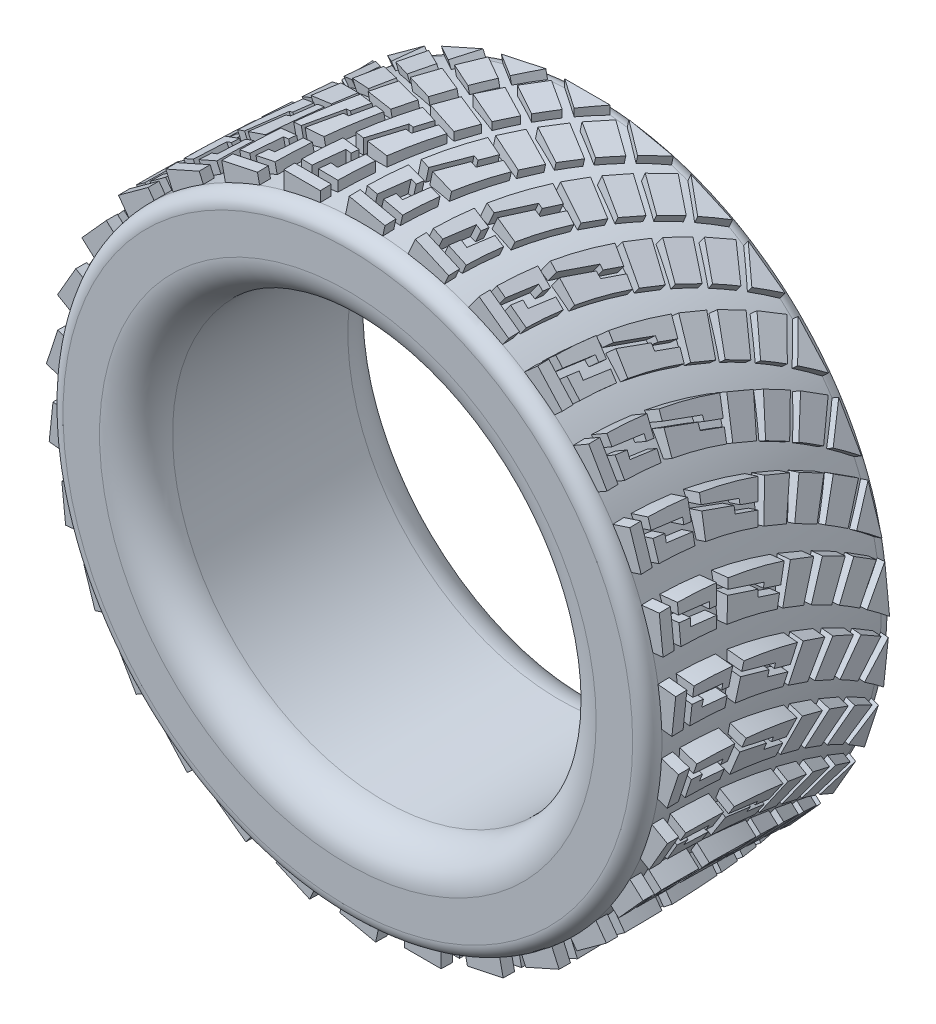
from build123d import *
from OCP.BRepFilletAPI import BRepFilletAPI_MakeFillet

# Parameters (mm, degrees)
SKETCH1_R           = 41
SKETCH1_R_2         = 29
EXTRUDE_THIN1_DEPTH = 34
FILLET2_R1          = 2
FILLET2_R2          = 5
BOSS_EXTRUDE1_START = -2.449619358
BOSS_EXTRUDE1_DEPTH = 2.449619358
CIRPATTERN1_COUNT   = 30


with BuildPart() as part:
    # Sketch1 → Extrude-Thin1 (new body)
    with BuildSketch(Plane.XY):
        Circle(SKETCH1_R)
        Circle(SKETCH1_R_2, mode=Mode.SUBTRACT)
    extrude(amount=EXTRUDE_THIN1_DEPTH)

    # Fillet2: one fillet with a radius per group of edges: ONE call of the kernel's fillet builder (fillet() takes one radius for all edges)
    fillet2_edges_1 = [part.edges().sort_by_distance(p)[0] for p in [
        (-41, 0, 34),
        (-41, 0, 0),
    ]]
    fillet2_edges_2 = [part.edges().sort_by_distance(p)[0] for p in [
        (-29, 0, 34),
        (-29, 0, 0),
    ]]
    fillet2 = BRepFilletAPI_MakeFillet(part.part.solid().wrapped)
    for e in fillet2_edges_1:
        fillet2.Add(FILLET2_R1, e.wrapped)
    for e in fillet2_edges_2:
        fillet2.Add(FILLET2_R2, e.wrapped)
    add(Compound.cast(fillet2.Shape()), mode=Mode.REPLACE)

    # Boss-Extrude1: read off the stored shape, not the designer's step
    # Boss-Extrude1 outline → Boss-Extrude1 (add)
    with BuildSketch(Plane(origin=(0, 42, 0), x_dir=(1, 0, 0), z_dir=(0, 1, 0)).offset(BOSS_EXTRUDE1_START)):
        with BuildLine():
            Line((-6.258934796, -15.838934168), (-8.649933082, -15.108746333))
            add(Edge.make_bspline(
                [(-8.649933082, -15.108746333), (-8.68114453, -15.210948383), (-9.162019087, -16.81134858), (-9.956110233, -20.25919443), (-10.274624614, -22.416239101), (-10.3017399, -22.61021976)],
                knots=[0.53286538, 0.53286538, 0.53286538, 0.538758611, 0.625, 0.732799571, 0.743424859, 0.743424859, 0.743424859], degree=2))
            Line((-10.3017399, -22.61021976), (-9.06537522, -22.783043885))
            Line((-9.06537522, -22.783043885), (-7.608624291, -18.012916436))
            Line((-7.608624291, -18.012916436), (-6.950824893, -18.104526643))
            Line((-6.950824893, -18.104526643), (-6.258934796, -15.838934168))
        make_face()
        with BuildLine():
            add(Edge.make_bspline(
                [(-3.86794551, -16.569119238), (-3.895867071, -16.660548322), (-4.376437345, -18.259929343), (-5.064563212, -21.360819699), (-5.325433932, -23.127526166), (-5.349880056, -23.302411034)],
                knots=[0.532865334, 0.532865334, 0.532865334, 0.538758611, 0.635779091, 0.732799571, 0.743424821, 0.743424821, 0.743424821], degree=2))
            Line((-3.86794551, -16.569119238), (-5.47021049, -16.079802966))
            Line((-5.47021049, -16.079802966), (-6.346710835, -18.949901258))
            Line((-6.346710835, -18.949901258), (-7.205418797, -18.830310978))
            Line((-7.205418797, -18.830310978), (-8.439272822, -22.870563045))
            Line((-8.439272822, -22.870563045), (-5.349880056, -23.302411034))
        make_face()
        with BuildLine():
            Line((-8.009929715, -24.439305874), (-10.495292367, -24.169139573))
            add(Edge.make_bspline(
                [(-10.495292367, -24.169139573), (-10.516569709, -24.364879117), (-10.653807924, -25.723160956), (-10.786895364, -28.076984935), (-10.804766651, -29.387894909), (-10.80589576, -29.508008548)],
                knots=[0.785925856, 0.785925856, 0.785925856, 0.796551073, 0.859493788, 0.922436502, 0.928777243, 0.928777243, 0.928777243], degree=2))
            Line((-10.80589576, -29.508008548), (-9.371350936, -29.521494646))
            Line((-9.371350936, -29.521494646), (-8.917520886, -25.346538844))
            Line((-8.917520886, -25.346538844), (-8.117996075, -25.433449557))
            Line((-8.117996075, -25.433449557), (-8.009929715, -24.439305874))
        make_face()
        with BuildLine():
            add(Edge.make_bspline(
                [(-5.524570504, -24.709471736), (-5.543797741, -24.886350424), (-5.667655735, -26.112238398), (-5.788508948, -28.243919669), (-5.805043572, -29.440873547), (-5.806116576, -29.555011269)],
                knots=[0.785925822, 0.785925822, 0.785925822, 0.796551073, 0.859359978, 0.922168883, 0.92877723, 0.92877723, 0.92877723], degree=2))
            Line((-5.524570504, -24.709471736), (-6.979000836, -24.551370894))
            Line((-6.979000836, -24.551370894), (-7.360589313, -28.061748897))
            Line((-7.360589313, -28.061748897), (-8.335519364, -27.955771115))
            Line((-8.335519364, -27.955771115), (-8.506601842, -29.529624117))
            Line((-8.506601842, -29.529624117), (-5.806116576, -29.555011269))
        make_face()
        with BuildLine():
            Line((-5.806661912, -30.471148169), (-10.806813102, -30.471148182))
            add(Edge.make_bspline(
                [(-10.806813102, -30.471148182), (-10.805914761, -30.591818362), (-10.79704232, -31.354377602), (-10.775367341, -32)],
                knots=[0.954140151, 0.954140151, 0.954140151, 0.960480871, 0.994163794, 0.994163794, 0.994163794], degree=2))
            Line((-10.775367341, -32), (-5.772291799, -31.999999985))
            add(Edge.make_bspline(
                [(-5.806661912, -30.471148169), (-5.805725512, -30.586044454), (-5.79619653, -31.347573944), (-5.772291799, -31.999999985)],
                knots=[0.95521062, 0.95521062, 0.95521062, 0.961818969, 0.998938813, 0.998938813, 0.998938813], degree=2))
        make_face()
        with BuildLine():
            add(Edge.make_bspline(
                [(3.928905977, -1.999999599), (3.759748812, -2.209802556), (2.750812295, -3.490470788), (1.898907005, -4.712157506), (1.815662438, -4.833205199)],
                knots=[0.024525426, 0.024525426, 0.024525426, 0.040509703, 0.121529108, 0.130408834, 0.130408834, 0.130408834], degree=2))
            Line((3.928905977, -1.999999599), (-2.304161381, -2))
            Line((-2.304161381, -2), (1.815662438, -4.833205199))
        make_face()
        with BuildLine():
            add(Edge.make_bspline(
                [(-2.632997735, -13.080738823), (-2.684525669, -13.208170382), (-2.96295471, -13.909925649), (-3.384691458, -15.071376248), (-3.608610637, -15.749426568), (-3.638140319, -15.840221546)],
                knots=[0.418508317, 0.418508317, 0.418508317, 0.427010141, 0.465204545, 0.503398949, 0.509292226, 0.509292226, 0.509292226], degree=2))
            Line((-2.632997735, -13.080738823), (-7.268383119, -11.206384977))
            Line((-7.268383119, -11.206384977), (-8.392982452, -14.293781671))
            Line((-8.392982452, -14.293781671), (-3.638140319, -15.840221546))
        make_face()
        with BuildLine():
            add(Edge.make_bspline(
                [(-0.936239239, -9.404060345), (-1.000831334, -9.528054331), (-1.338403265, -10.186590755), (-1.854549583, -11.267815759), (-2.152544379, -11.940561595), (-2.207412329, -12.066650978)],
                knots=[0.293429844, 0.293429844, 0.293429844, 0.302037714, 0.339018457, 0.3759992, 0.384501023, 0.384501023, 0.384501023], degree=2))
            Line((-0.936239239, -9.404060345), (-5.370635373, -7.094053652))
            Line((-5.370635373, -7.094053652), (-6.792144418, -10.071599183))
            Line((-6.792144418, -10.071599183), (-2.207412329, -12.066650978))
        make_face()
        with BuildLine():
            add(Edge.make_bspline(
                [(1.164140596, -5.807600623), (1.084505664, -5.930151201), (0.670696016, -6.576239845), (0.033293463, -7.636141093), (-0.33785596, -8.295095246), (-0.405858347, -8.417692403)],
                knots=[0.165927736, 0.165927736, 0.165927736, 0.174807462, 0.212598976, 0.250390491, 0.258998362, 0.258998362, 0.258998362], degree=2))
            Line((1.164140596, -5.807600623), (-3.028436129, -3.083210708))
            Line((-3.028436129, -3.083210708), (-4.778265999, -5.992398333))
            Line((-4.778265999, -5.992398333), (-0.405858347, -8.417692403))
        make_face()
    boss_extrude1 = extrude(amount=BOSS_EXTRUDE1_DEPTH)

    # CirPattern1: Boss-Extrude1 ×30 about axis
    cirpattern1_axis = Axis((0, 0, 34), (0, 0, -1))
    for i in range(1, CIRPATTERN1_COUNT):
        add(boss_extrude1.rotate(cirpattern1_axis, i * 360 / CIRPATTERN1_COUNT))


solid = part.part
